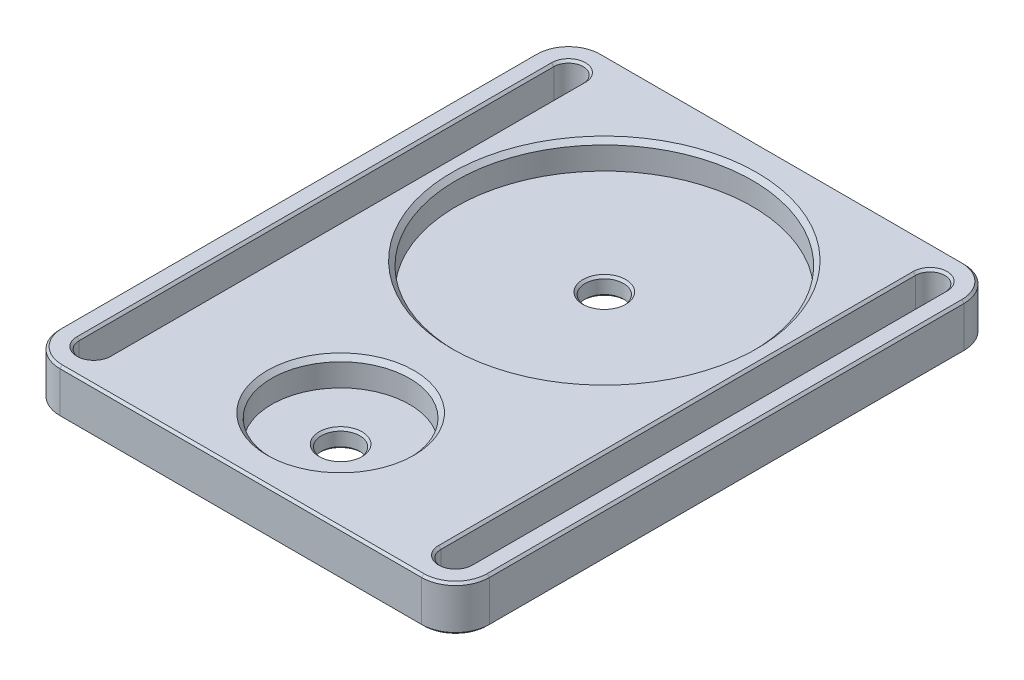
from build123d import *

# Parameters (mm, degrees)
BOSS_EXTRUDE1_DEPTH = 10
SKETCH1_4_R         = 4.25
CUT_EXTRUDE2_DEPTH  = 94.934159921
CUT_EXTRUDE3_START  = 4
SKETCH1_6_R         = 32.75
SKETCH1_6_R_2       = 4.25
SKETCH1_6_R_3       = 15.25
CUT_EXTRUDE3_DEPTH  = 90.934159921
CHAMFER1_SIZE       = 1
CHAMFER2_SIZE       = 0.5


with BuildPart() as part:
    # Sketch1 → Boss-Extrude1 (new body)
    with BuildSketch(Plane(origin=(0, 0, 0), x_dir=(1, 0, 0), z_dir=(0, 1, 0))):
        with BuildLine():
            ThreePointArc((-47.5, -72.92), (-45.303300859, -78.223300859), (-40, -80.42))
            Line((-40, -80.42), (40, -80.42))
            ThreePointArc((40, -80.42), (45.303300859, -78.223300859), (47.5, -72.92))
            Line((47.5, -72.92), (47.5, 32.08))
            ThreePointArc((47.5, 32.08), (45.303300859, 37.383300859), (40, 39.58))
            Line((40, 39.58), (-40, 39.58))
            ThreePointArc((-40, 39.58), (-45.303300859, 37.383300859), (-47.5, 32.08))
            Line((-47.5, 32.08), (-47.5, -72.92))
        make_face()
    extrude(amount=BOSS_EXTRUDE1_DEPTH)

    # Sketch1<4> → Cut-Extrude2 (cut, through all)
    with BuildSketch(Plane(origin=(0, 0, 0), x_dir=(1, 0, 0), z_dir=(0, 1, 0))):
        with BuildLine():
            Line((-36.75, -72.92), (-36.75, 32.08))
            ThreePointArc((-36.75, 32.08), (-40, 35.33), (-43.25, 32.08))
            Line((-43.25, 32.08), (-43.25, -72.92))
            ThreePointArc((-43.25, -72.92), (-40, -76.17), (-36.75, -72.92))
        make_face()
        with BuildLine():
            Line((43.25, -72.92), (43.25, 32.08))
            ThreePointArc((43.25, 32.08), (40, 35.33), (36.75, 32.08))
            Line((36.75, 32.08), (36.75, -72.92))
            ThreePointArc((36.75, -72.92), (40, -76.17), (43.25, -72.92))
        make_face()
        Circle(SKETCH1_4_R)
        with Locations((0, -58.34)):
            Circle(SKETCH1_4_R)
    extrude(amount=CUT_EXTRUDE2_DEPTH, mode=Mode.SUBTRACT)

    # Sketch1<6> → Cut-Extrude3 (cut, through all)
    # profile 1 of 2: a face of its own
    with BuildSketch(Plane(origin=(0, 0, 0), x_dir=(1, 0, 0), z_dir=(0, 1, 0)).offset(CUT_EXTRUDE3_START)):
        Circle(SKETCH1_6_R)
        Circle(SKETCH1_6_R_2, mode=Mode.SUBTRACT)
    # profile 2 of 2: a face of its own
    with BuildSketch(Plane(origin=(0, 0, 0), x_dir=(1, 0, 0), z_dir=(0, 1, 0)).offset(CUT_EXTRUDE3_START)):
        with Locations((0, -58.34)):
            Circle(SKETCH1_6_R_3)
        with Locations((0, -58.34)):
            Circle(SKETCH1_6_R_2, mode=Mode.SUBTRACT)
    extrude(amount=CUT_EXTRUDE3_DEPTH, mode=Mode.SUBTRACT)

    # Chamfer1
    chamfer1_edges = [part.edges().sort_by_distance(p)[0] for p in [
        (-15.25, 10, 58.34),
        (-32.75, 10, 0),
    ]]
    chamfer(chamfer1_edges, length=CHAMFER1_SIZE)

    # Chamfer2
    chamfer2_edges = [part.edges().sort_by_distance(p)[0] for p in [
        (-4.25, 4, 58.34),
        (-4.25, 0, 58.34),
        (-4.25, 4, 0),
        (-4.25, 0, 0),
        (43.25, 10, 20.42),
        (40, 10, -35.33),
        (40, 10, 76.17),
        (36.75, 10, 20.42),
        (43.25, 0, 20.42),
        (40, 0, -35.33),
        (40, 0, 76.17),
        (36.75, 0, 20.42),
        (-36.75, 10, 20.42),
        (-40, 10, -35.33),
        (-40, 10, 76.17),
        (-43.25, 10, 20.42),
        (-36.75, 0, 20.42),
        (-40, 0, -35.33),
        (-40, 0, 76.17),
        (-43.25, 0, 20.42),
        (0, 10, -39.58),
        (-45.303300859, 10, -37.383300859),
        (45.303300859, 10, -37.383300859),
        (-47.5, 10, 20.42),
        (47.5, 10, 20.42),
        (-45.303300859, 10, 78.223300859),
        (45.303300859, 10, 78.223300859),
        (0, 10, 80.42),
        (0, 0, -39.58),
        (-45.303300859, 0, -37.383300859),
        (45.303300859, 0, -37.383300859),
        (-47.5, 0, 20.42),
        (47.5, 0, 20.42),
        (-45.303300859, 0, 78.223300859),
        (45.303300859, 0, 78.223300859),
        (0, 0, 80.42),
    ]]
    chamfer(chamfer2_edges, length=CHAMFER2_SIZE)


solid = part.part
